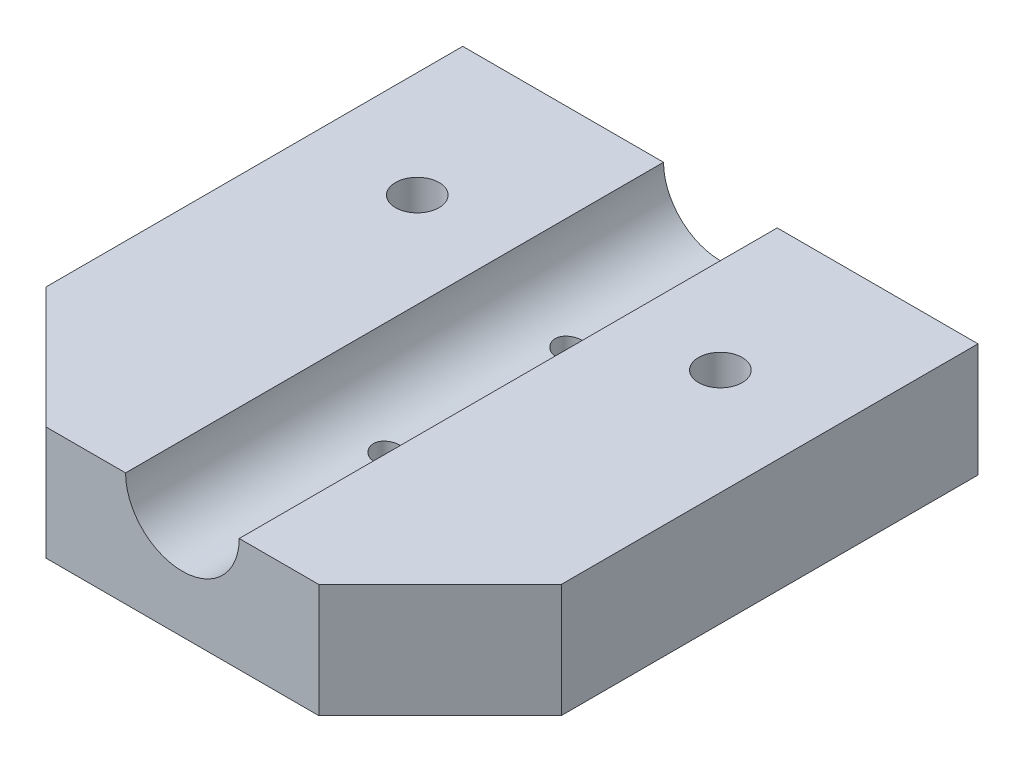
from build123d import *

# Parameters (mm, degrees)
SKETCH1_W                                      = 43.18
SKETCH1_H                                      = 45.085
BOSS_EXTRUDE1_DEPTH                            = 9.525
SKETCH4_R                                      = 4.7625
CUT_EXTRUDE1_DEPTH                             = 51.887237595
MOTORHOLES_D                                   = 2.2606
MOTORHOLES_DEPTH                               = 6.35
MOTORHOLES_TIP                                 = 0.679152758
CBORE_FOR_6_SOCKET_HEAD_CAP_SCREW1_D           = 3.6576
CBORE_FOR_6_SOCKET_HEAD_CAP_SCREW1_CBORE_D     = 7.14502
CBORE_FOR_6_SOCKET_HEAD_CAP_SCREW1_CBORE_DEPTH = 3.5052
CHAMFER1_SIZE                                  = 10.16
F_4_40_TAPPED_HOLE1_D                          = 2.2606


with BuildPart() as part:
    # Sketch1 → Boss-Extrude1 (new body)
    with BuildSketch(Plane(origin=(0, 0, 0), x_dir=(1, 0, 0), z_dir=(0, 1, 0))):
        Rectangle(SKETCH1_W, SKETCH1_H)
    extrude(amount=BOSS_EXTRUDE1_DEPTH)

    # Sketch4 → Cut-Extrude1 (cut, through all)
    with BuildSketch(Plane.XY.offset(22.5425)):
        with Locations((0, 9.525)):
            Circle(SKETCH4_R)
    extrude(amount=-CUT_EXTRUDE1_DEPTH, mode=Mode.SUBTRACT)

    # MotorHoles
    with Locations(Plane(origin=(0, 0, 0), x_dir=(-1, 0, 0), z_dir=(0, -1, 0))):
        with Locations((-5.715, -19.3675), (5.715, -19.3675), (13.081, 19.6469), (-13.081, 19.6469)):
            Hole(MOTORHOLES_D / 2, depth=MOTORHOLES_DEPTH)
            with Locations((0, 0, -(MOTORHOLES_DEPTH + MOTORHOLES_TIP / 2))):  # 118° drill point
                Cone(0, MOTORHOLES_D / 2, MOTORHOLES_TIP, mode=Mode.SUBTRACT)

    # CBORE for #6 Socket Head Cap Screw1 (through all)
    with Locations(Plane(origin=(0, 0, 0), x_dir=(-1, 0, 0), z_dir=(0, -1, 0))):
        with Locations((-12.7, 9.8425), (12.7, 9.8425)):
            CounterBoreHole(CBORE_FOR_6_SOCKET_HEAD_CAP_SCREW1_D / 2, CBORE_FOR_6_SOCKET_HEAD_CAP_SCREW1_CBORE_D / 2, CBORE_FOR_6_SOCKET_HEAD_CAP_SCREW1_CBORE_DEPTH)

    # Chamfer1
    chamfer1_edges = [part.edges().sort_by_distance(p)[0] for p in [
        (21.59, 4.7625, 22.5425),
        (-21.59, 4.7625, 22.5425),
    ]]
    chamfer(chamfer1_edges, length=CHAMFER1_SIZE)

    # #4-40 Tapped Hole1 (through all)
    with Locations(Plane(origin=(0, 0, 0), x_dir=(-1, 0, 0), z_dir=(0, -1, 0))):
        with Locations((0, 9.8425), (0, -5.3975)):
            Hole(F_4_40_TAPPED_HOLE1_D / 2)


solid = part.part
